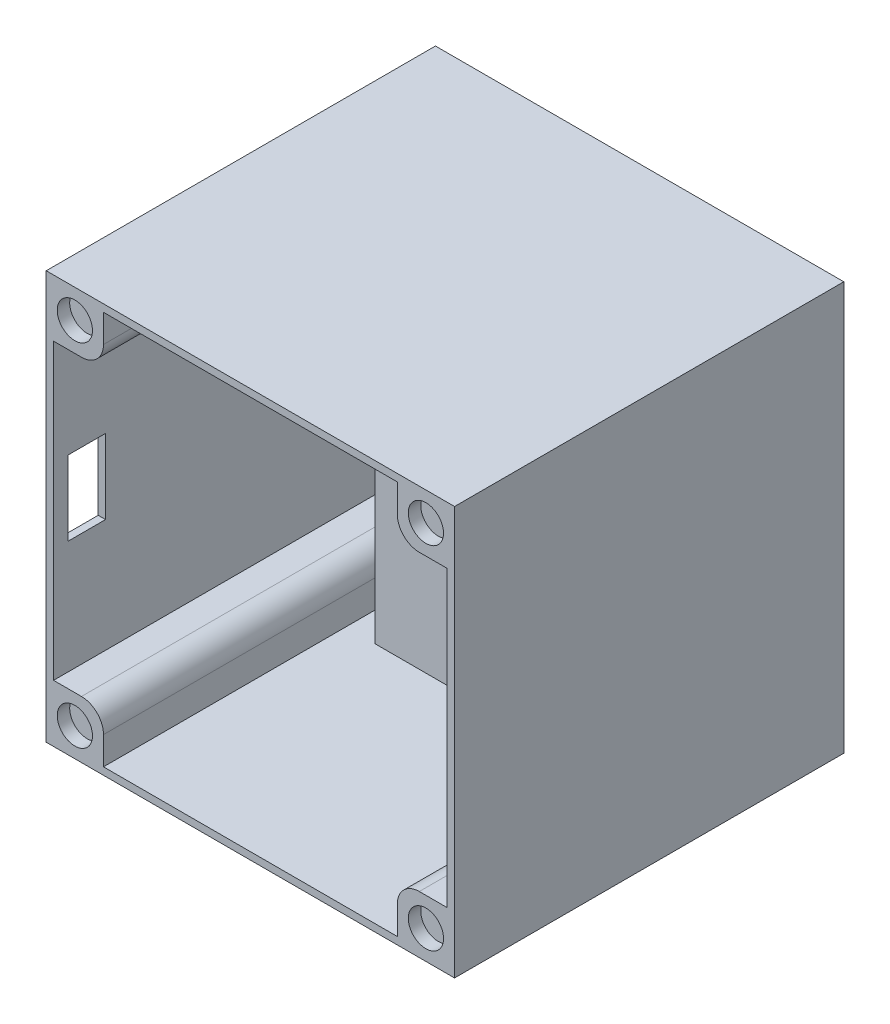
from build123d import *

# Parameters (mm, degrees)
SKICA1_W                  = 55.6
SKICA1_H                  = 55.6
P_IDAT_VYSUNUT_M2_DEPTH   = 3
SKICA14_W                 = 53.6
SKICA14_H                 = 1
P_IDAT_VYSUNUT_M9_DEPTH   = 50
SKICA19_W                 = 7.8
SKICA19_H                 = 7.8
P_IDAT_VYSUNUT_M10_DEPTH  = 53
SKICA20_R                 = 2.4
ODEBRAT_VYSUNUT_M9_DEPTH  = 1.7
ZAOBLIT1_R                = 3
SKICA25_W                 = 32
SKICA25_H                 = 55.6
P_IDAT_VYSUNUT_M12_DEPTH  = 20
SKICA26_W                 = 30
SKICA26_H                 = 53
ODEBRAT_VYSUNUT_M11_DEPTH = 19
SKICA27_W                 = 5.08
SKICA27_H                 = 10.16
ODEBRAT_VYSUNUT_M12_DEPTH = 1
SKICA28_W                 = 9
SKICA28_H                 = 8
ODEBRAT_VYSUNUT_M13_DEPTH = 1
ZAOBLIT3_R                = 4
SKICA29_W                 = 0.5
SKICA29_H                 = 4
ODEBRAT_VYSUNUT_M14_DEPTH = 2
SKICA30_R                 = 0.9
ODEBRAT_VYSUNUT_M15_DEPTH = 2
SKICA31_W                 = 6
SKICA31_H                 = 4
ODEBRAT_VYSUNUT_M16_DEPTH = 2
ZAOBLIT4_R                = 1


with BuildPart() as part:
    # Skica1 → Přidat vysunutím2 (new body)
    with BuildSketch(Plane.XY):
        Rectangle(SKICA1_W, SKICA1_H)
    extrude(amount=P_IDAT_VYSUNUT_M2_DEPTH)

    # Skica14 → Přidat vysunutím9 (add)
    with BuildSketch(Plane.XY.offset(3)):
        Polygon((27.8, 27.8), (-27.8, 27.8), (-27.8, -27.8), (-26.8, -27.8), (-26.8, -26.8), (-26.8, 26.8), (26.8, 26.8), (26.8, -26.8), (26.8, -27.8), (27.8, -27.8), align=None)
        with Locations((0, -27.3)):
            Rectangle(SKICA14_W, SKICA14_H)
    extrude(amount=P_IDAT_VYSUNUT_M9_DEPTH)

    # Skica19 → Přidat vysunutím10 (add)
    with BuildSketch(Plane(origin=(0, 0, 0), x_dir=(-1, 0, 0), z_dir=(0, 0, -1))):
        with Locations((-23.9, 23.9)):
            Rectangle(SKICA19_W, SKICA19_H)
        with Locations((23.9, 23.9)):
            Rectangle(SKICA19_W, SKICA19_H)
        with Locations((-23.9, -23.9)):
            Rectangle(SKICA19_W, SKICA19_H)
        with Locations((23.9, -23.9)):
            Rectangle(SKICA19_W, SKICA19_H)
    extrude(amount=-P_IDAT_VYSUNUT_M10_DEPTH)

    # Skica20 → Odebrat vysunutím9 (cut)
    with BuildSketch(Plane.XY.offset(53)):
        with Locations((-23.9, -23.9)):
            Circle(SKICA20_R)
        with Locations((-23.9, 23.9)):
            Circle(SKICA20_R)
        with Locations((23.900280565, 23.9)):
            Circle(SKICA20_R)
        with Locations((23.900280565, -23.9)):
            Circle(SKICA20_R)
    extrude(amount=-ODEBRAT_VYSUNUT_M9_DEPTH, mode=Mode.SUBTRACT)

    # Zaoblit1
    zaoblit1_edges = [part.edges().sort_by_distance(p)[0] for p in [
        (-20, -20, 28),
        (20, 20, 28),
        (-20, 20, 28),
        (20, -20, 28),
    ]]
    fillet(zaoblit1_edges, radius=ZAOBLIT1_R)

    # Skica25 → Přidat vysunutím12 (add)
    with BuildSketch(Plane(origin=(0, 0, 0), x_dir=(-1, 0, 0), z_dir=(0, 0, -1))):
        Rectangle(SKICA25_W, SKICA25_H)
    extrude(amount=-P_IDAT_VYSUNUT_M12_DEPTH)

    # Skica26 → Odebrat vysunutím11 (cut)
    with BuildSketch(Plane(origin=(0, 0, 0), x_dir=(-1, 0, 0), z_dir=(0, 0, -1))):
        Rectangle(SKICA26_W, SKICA26_H)
    extrude(amount=-ODEBRAT_VYSUNUT_M11_DEPTH, mode=Mode.SUBTRACT)

    # Skica27 → Odebrat vysunutím12 (cut)
    with BuildSketch(Plane.ZY.offset(27.8)):
        with Locations((48.46, 0.5)):
            Rectangle(SKICA27_W, SKICA27_H)
    extrude(amount=-ODEBRAT_VYSUNUT_M12_DEPTH, mode=Mode.SUBTRACT)

    # Skica28 → Odebrat vysunutím13 (cut)
    with BuildSketch(Plane(origin=(0, 0, 0), x_dir=(-1, 0, 0), z_dir=(0, 0, -1))):
        with Locations((-19.5, 16.940262317)):
            Rectangle(SKICA28_W, SKICA28_H)
    extrude(amount=-ODEBRAT_VYSUNUT_M13_DEPTH, mode=Mode.SUBTRACT)

    # Zaoblit3
    zaoblit3_edges = [part.edges().sort_by_distance(p)[0] for p in [
        (24, 12.940262317, 0.5),
        (24, 20.940262317, 0.5),
    ]]
    fillet(zaoblit3_edges, radius=ZAOBLIT3_R - 0.0001)  # a hair under: the kernel refuses the full size

    # Skica29 → Odebrat vysunutím14 (cut)
    with BuildSketch(Plane(origin=(-15, 0, 0), x_dir=(0, 0, -1), z_dir=(1, 0, 0))):
        with Locations((-0.75, 19.5)):
            Rectangle(SKICA29_W, SKICA29_H)
        with Locations((-0.83, -19.5)):
            Rectangle(SKICA29_W, SKICA29_H)
    extrude(amount=-ODEBRAT_VYSUNUT_M14_DEPTH, mode=Mode.SUBTRACT)

    # Skica30 → Odebrat vysunutím15 (cut)
    with BuildSketch(Plane(origin=(0, 0, 1), x_dir=(-1, 0, 0), z_dir=(0, 0, -1))):
        with Locations((-20, 16.940262317)):
            Circle(SKICA30_R)
    extrude(amount=-ODEBRAT_VYSUNUT_M15_DEPTH, mode=Mode.SUBTRACT)

    # Skica31 → Odebrat vysunutím16 (cut)
    with BuildSketch(Plane(origin=(0, 0, 19), x_dir=(-1, 0, 0), z_dir=(0, 0, -1))):
        with Locations((-12, 24.5)):
            Rectangle(SKICA31_W, SKICA31_H)
    extrude(amount=-ODEBRAT_VYSUNUT_M16_DEPTH, mode=Mode.SUBTRACT)

    # Zaoblit4
    zaoblit4_edges = [part.edges().sort_by_distance(p)[0] for p in [
        (9, 22.5, 19.5),
    ]]
    fillet(zaoblit4_edges, radius=ZAOBLIT4_R)


solid = part.part
